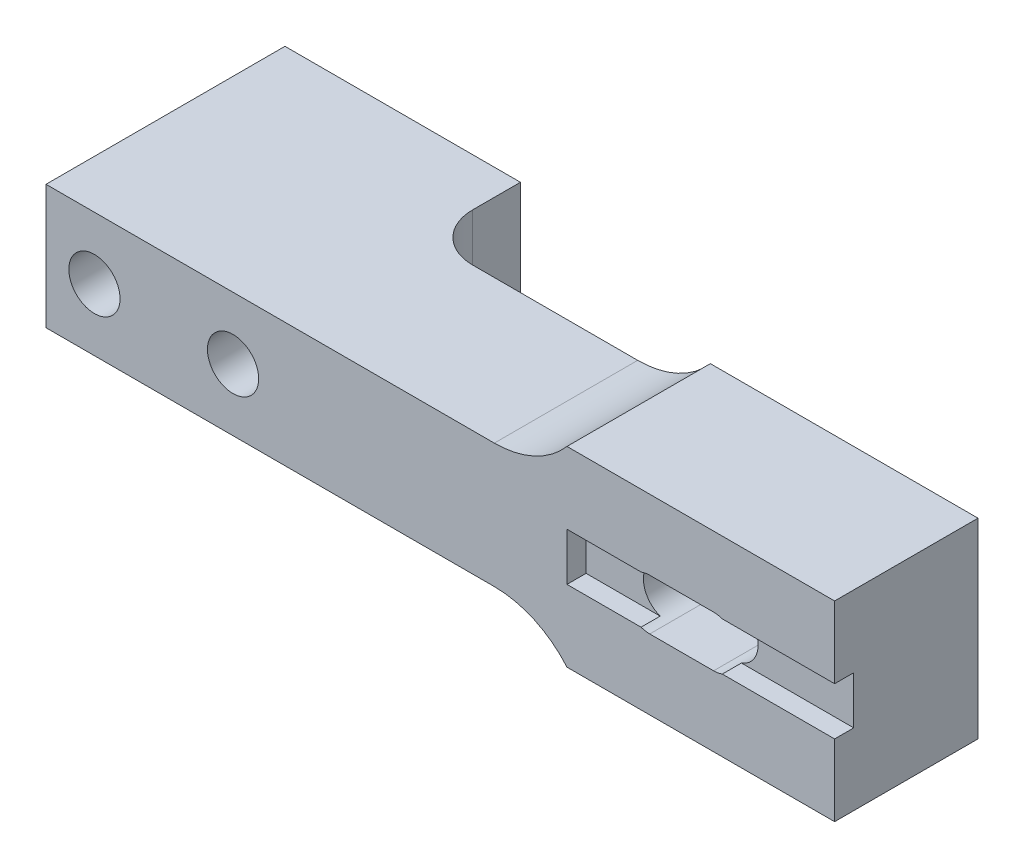
from build123d import *

# Parameters (mm, degrees)
SKETCH1_W           = 24.634
SKETCH1_H           = 13
BOSS_EXTRUDE1_DEPTH = 10
SKETCH4_W           = 82.5
SKETCH4_H           = 13
BOSS_EXTRUDE4_DEPTH = 15
SKETCH5_W           = 28
SKETCH5_H           = 3.5
BOSS_EXTRUDE5_DEPTH = 15
CUT_EXTRUDE1_DEPTH  = 88.769584709
SKETCH7_W           = 28
SKETCH7_H           = 5
CUT_EXTRUDE2_DEPTH  = 2
SKETCH11_R          = 2.68
CUT_EXTRUDE3_DEPTH  = 88.769584709
FILLET1_R           = 10
FILLET2_R           = 5


with BuildPart() as part:
    # Sketch1 → Boss-Extrude1 (new body)
    with BuildSketch(Plane.XY):
        with Locations((12.317, 6.5)):
            Rectangle(SKETCH1_W, SKETCH1_H)
    extrude(amount=BOSS_EXTRUDE1_DEPTH)

    # Sketch4 → Boss-Extrude4 (add)
    with BuildSketch(Plane.XY.offset(10)):
        with Locations((41.25, 6.5)):
            Rectangle(SKETCH4_W, SKETCH4_H)
    extrude(amount=BOSS_EXTRUDE4_DEPTH)

    # Sketch5 → Boss-Extrude5 (add)
    with BuildSketch(Plane.XY.offset(25)):
        with Locations((68.5, -1.75)):
            Rectangle(SKETCH5_W, SKETCH5_H)
        with Locations((68.5, 14.75)):
            Rectangle(SKETCH5_W, SKETCH5_H)
    extrude(amount=-BOSS_EXTRUDE5_DEPTH)

    # Sketch6 → Cut-Extrude1 (cut, through all)
    with BuildSketch(Plane.XY.offset(25)):
        with BuildLine():
            Line((63.16, 9.16), (69.84, 9.16))
            ThreePointArc((69.84, 9.16), (72.5, 6.5), (69.84, 3.84))
            Line((69.84, 3.84), (63.16, 3.84))
            ThreePointArc((63.16, 3.84), (60.5, 6.5), (63.16, 9.16))
        make_face()
    extrude(amount=-CUT_EXTRUDE1_DEPTH, mode=Mode.SUBTRACT)

    # Sketch7 → Cut-Extrude2 (cut)
    with BuildSketch(Plane.XY.offset(25)):
        with Locations((68.5, 6.5)):
            Rectangle(SKETCH7_W, SKETCH7_H)
    extrude(amount=-CUT_EXTRUDE2_DEPTH, mode=Mode.SUBTRACT)

    # Sketch11 → Cut-Extrude3 (cut, through all)
    with BuildSketch(Plane(origin=(0, 0, 0), x_dir=(-1, 0, 0), z_dir=(0, 0, -1))):
        with Locations((-5.067, 6.5)):
            Circle(SKETCH11_R)
        with Locations((-19.567, 6.5)):
            Circle(SKETCH11_R)
    extrude(amount=-CUT_EXTRUDE3_DEPTH, mode=Mode.SUBTRACT)

    # Fillet1
    # the kernel refuses this fillet: 10 mm, written as the material it adds along each edge
    with BuildSketch(Plane(origin=(54.5, 13, 25), x_dir=(-1, 0, 0), z_dir=(0, 0, -1))) as fillet1_piece_1:
        with BuildLine():
            CenterArc((7.599342077, 10), FILLET1_R, 220.541601874, 49.458398126)
            Line((0, 3.5), (-0.151986842, 3.37))
            ThreePointArc((-0.151986842, 3.37), (-0.2, 1.75), (-0.2, 0))
            Line((-0.2, 0), (0, -0.2))
            Line((0, -0.2), (7.599342077, -0.2))
            Line((7.599342077, -0.2), (7.599342077, 0))
        make_face()
    extrude(amount=15)
    with BuildSketch(Plane(origin=(54.5, 0, 25), x_dir=(-1, 0, 0), z_dir=(0, 0, -1))) as fillet1_piece_2:
        with BuildLine():
            CenterArc((7.599342077, -10), FILLET1_R, 90, 49.458398126)
            Line((0, -3.5), (-0.151986842, -3.37))
            ThreePointArc((-0.151986842, -3.37), (-0.2, -1.75), (-0.2, 0))
            Line((-0.2, 0), (0, 0.2))
            Line((0, 0.2), (7.599342077, 0.2))
            Line((7.599342077, 0.2), (7.599342077, 0))
        make_face()
    extrude(amount=15)

    # Fillet2
    fillet2_edges = [part.edges().sort_by_distance(p)[0] for p in [
        (24.634, 6.5, 10),
    ]]
    fillet(fillet2_edges, radius=FILLET2_R)


solid = part.part
